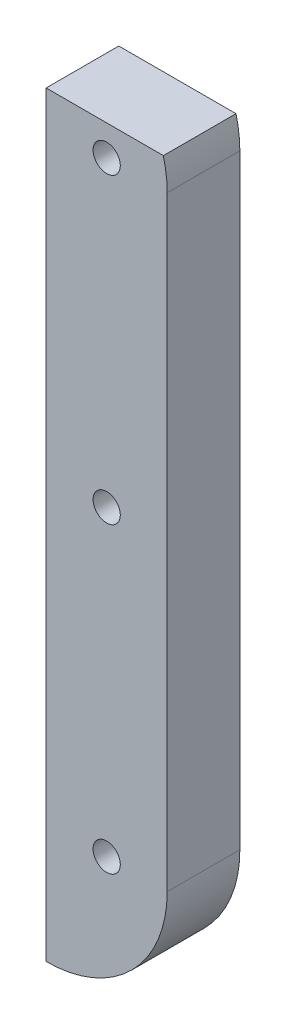
from build123d import *

# Parameters (mm, degrees)
SKETCH_1_W          = 20
SKETCH_1_H          = 140
SKETCH_1_R          = 2.25
EXTRUDE_1_DEPTH     = 12
FILLET_1_R          = 20
SKETCH_2_W          = 19.364916731
SKETCH_2_H          = 15
CUT_EXTRUDE_1_DEPTH = 72.721684308


with BuildPart() as part:
    # 草图1 → 凸台-拉伸1 (new body)
    with BuildSketch(Plane.XY):
        Rectangle(SKETCH_1_W, SKETCH_1_H)
        with Locations((0, -50)):
            Circle(SKETCH_1_R, mode=Mode.SUBTRACT)
        Circle(SKETCH_1_R, mode=Mode.SUBTRACT)
        with Locations((0, 50)):
            Circle(SKETCH_1_R, mode=Mode.SUBTRACT)
    extrude(amount=EXTRUDE_1_DEPTH)

    # 圆角1
    fillet_1_edges = [part.edges().sort_by_distance(p)[0] for p in [
        (10, -70, 6),
        (10, 70, 6),
    ]]
    fillet(fillet_1_edges, radius=FILLET_1_R - 0.0001)  # a hair under: the kernel refuses the full size

    # 草图2 → 切除-拉伸1 (cut, through all)
    with BuildSketch(Plane.XY.offset(12)):
        with Locations((-0.317541634, 62.5)):
            Rectangle(SKETCH_2_W, SKETCH_2_H)
    extrude(amount=-CUT_EXTRUDE_1_DEPTH, mode=Mode.SUBTRACT)


solid = part.part
